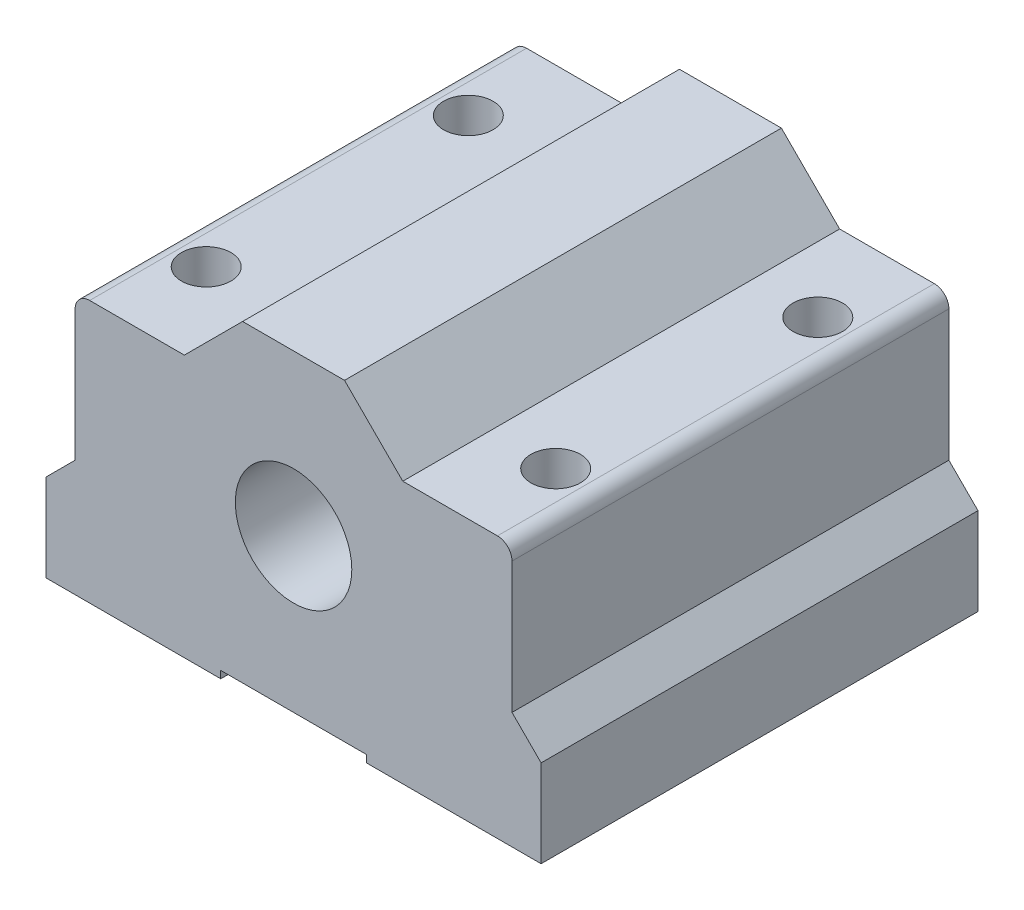
from build123d import *
from build123d.topology import SkipClean

# Parameters (mm, degrees)
SKETCH_1_W          = 34
SKETCH_1_H          = 22
EXTRUDE_1_DEPTH     = 30
SKETCH_2_R          = 4
CUT_EXTRUDE_1_DEPTH = 51.398412673
SKETCH_3_W          = 10
SKETCH_3_H          = 0.5
CUT_EXTRUDE_2_DEPTH = 51.398412673
FILLET_1_R          = 1
SKETCH_4_R          = 1.7
CUT_EXTRUDE_3_DEPTH = 51.398412673
THREAD_1_PITCH      = 0.7
THREAD_2_PITCH      = 0.7
THREAD_3_PITCH      = 0.7
THREAD_4_PITCH      = 0.7


with BuildPart() as part:
    # Sketch 1 → 凸台-拉伸1 (new body)
    with BuildSketch(Plane.XY):
        with Locations((17, 11)):
            Rectangle(SKETCH_1_W, SKETCH_1_H)
    extrude(amount=EXTRUDE_1_DEPTH)

    # Sketch 2 → 切除-拉伸1 (cut, through all)
    with BuildSketch(Plane.XY.offset(30)):
        Polygon((0, 22), (0, 18), (9.5, 18), (13.5, 22), align=None)
        Polygon((34, 22), (20.5, 22), (24.5, 18), (34, 18), align=None)
        with Locations((17, 11)):
            Circle(SKETCH_2_R)
    extrude(amount=-CUT_EXTRUDE_1_DEPTH, mode=Mode.SUBTRACT)

    # Sketch 3 → 切除-拉伸2 (cut, through all)
    with BuildSketch(Plane.XY.offset(30)):
        Polygon((0, 6), (2, 8), (2, 18), (0, 18), align=None)
        with Locations((17, 0.25)):
            Rectangle(SKETCH_3_W, SKETCH_3_H)
        Polygon((34, 6), (32, 8), (32, 18), (34, 18), align=None)
    extrude(amount=-CUT_EXTRUDE_2_DEPTH, mode=Mode.SUBTRACT)

    # 圆角1
    fillet_1_edges = [part.edges().sort_by_distance(p)[0] for p in [
        (2, 18, 15),
        (32, 18, 15),
    ]]
    fillet(fillet_1_edges, radius=FILLET_1_R)

    # Sketch 4 → 切除-拉伸3 (cut, through all)
    with BuildSketch(Plane.XZ):
        with Locations(Location((5, 24, 0), (0, 0, 270))):
            Circle(SKETCH_4_R)
        with Locations(Location((29, 24, 0), (0, 0, 90))):
            Circle(SKETCH_4_R)
        with Locations(Location((5, 6, 0), (0, 0, 270))):
            Circle(SKETCH_4_R)
        with Locations(Location((29, 6, 0), (0, 0, 270))):
            Circle(SKETCH_4_R)
    extrude(amount=-CUT_EXTRUDE_3_DEPTH, mode=Mode.SUBTRACT)

    # 螺纹线1: the profile of Sketch 1 2 profile screwed along a right-hand helix of 11.428571 turns, 6 arcs to a turn; built about Z, then put on its axis
    thread_1_z = Axis((0, 0, 0), (0, 0, 1))
    thread_1_corners = [(1.7003, 0, -0.000173205), (1.7003, 0, 0.612673203), (1.321113887, 0, 0.393749999), (1.321113887, 0, 0.218749999)]
    with BuildLine(mode=Mode.PRIVATE) as thread_1_profile:
        Line(thread_1_corners[0], thread_1_corners[1])
        Line(thread_1_corners[1], thread_1_corners[2])
        Line(thread_1_corners[2], thread_1_corners[3])
        Line(thread_1_corners[3], thread_1_corners[0])
    thread_1_cap = Face(thread_1_profile.wire())
    thread_1_turn_angles = [0, 30, 60, 90, 120, 150, 180, 210, 240, 270, 300, 330, 360]
    thread_1_turn_weights = [1, 0.8660254037844387, 1, 0.8660254037844387, 1, 0.8660254037844387, 1, 0.8660254037844387, 1, 0.8660254037844387, 1, 0.8660254037844387, 1]
    thread_1_turn_rails = [Edge.make_bspline([Vector(p[0], p[1], 0).rotate(thread_1_z, thread_1_turn_angles[k]) / thread_1_turn_weights[k] + Vector(0, 0, p[2] + THREAD_1_PITCH * thread_1_turn_angles[k] / 360) for k in range(13)], [0, 0, 0, 1, 1, 2, 2, 3, 3, 4, 4, 5, 5, 6, 6, 6], 2, thread_1_turn_weights) for p in thread_1_corners]
    thread_1_turn_sides = [Face.make_surface_from_curves(thread_1_turn_rails[p[0]], thread_1_turn_rails[p[1]]) for p in [(0, 1), (1, 2), (2, 3), (3, 0)]]
    thread_1_last_angles = [3960, 3990, 4020, 4050, 4080, 4097.142857143, 4114.285714286]
    thread_1_last_weights = [1, 0.8660254037844387, 1, 0.8660254037844387, 1, 0.9555728057861397, 1]
    thread_1_last_rails = [Edge.make_bspline([Vector(p[0], p[1], 0).rotate(thread_1_z, thread_1_last_angles[k]) / thread_1_last_weights[k] + Vector(0, 0, p[2] + THREAD_1_PITCH * thread_1_last_angles[k] / 360) for k in range(7)], [0, 0, 0, 1, 1, 2, 2, 3, 3, 3], 2, thread_1_last_weights) for p in thread_1_corners]
    thread_1_last_sides = [Face.make_surface_from_curves(thread_1_last_rails[p[0]], thread_1_last_rails[p[1]]) for p in [(0, 1), (1, 2), (2, 3), (3, 0)]]
    thread_1 = Plane(origin=(5, 0, 24), x_dir=(1, 0, 0), z_dir=(0, 1, 0)) * Solid(Shell([*[p.moved(Location((0, 0, THREAD_1_PITCH * i))) for i in range(11) for p in thread_1_turn_sides], *thread_1_last_sides, thread_1_cap, thread_1_cap.rotate(thread_1_z, 4114.285714286).moved(Location((0, 0, THREAD_1_PITCH * 4114.285714286 / 360)))]))
    add(thread_1)

    # 螺纹线2: the profile of Sketch 2 2 profile screwed along a right-hand helix of 11.428571 turns, 6 arcs to a turn; built about Z, then put on its axis
    with SkipClean():  # the faces are left unmerged after this step: merging them gives an invalid solid
        thread_2_z = Axis((0, 0, 0), (0, 0, 1))
        thread_2_corners = [(1.7003, 0, -0.000173205), (1.7003, 0, 0.612673203), (1.321113887, 0, 0.393749999), (1.321113887, 0, 0.218749999)]
        with BuildLine(mode=Mode.PRIVATE) as thread_2_profile:
            Line(thread_2_corners[0], thread_2_corners[1])
            Line(thread_2_corners[1], thread_2_corners[2])
            Line(thread_2_corners[2], thread_2_corners[3])
            Line(thread_2_corners[3], thread_2_corners[0])
        thread_2_cap = Face(thread_2_profile.wire())
        thread_2_turn_angles = [0, 30, 60, 90, 120, 150, 180, 210, 240, 270, 300, 330, 360]
        thread_2_turn_weights = [1, 0.8660254037844387, 1, 0.8660254037844387, 1, 0.8660254037844387, 1, 0.8660254037844387, 1, 0.8660254037844387, 1, 0.8660254037844387, 1]
        thread_2_turn_rails = [Edge.make_bspline([Vector(p[0], p[1], 0).rotate(thread_2_z, thread_2_turn_angles[k]) / thread_2_turn_weights[k] + Vector(0, 0, p[2] + THREAD_2_PITCH * thread_2_turn_angles[k] / 360) for k in range(13)], [0, 0, 0, 1, 1, 2, 2, 3, 3, 4, 4, 5, 5, 6, 6, 6], 2, thread_2_turn_weights) for p in thread_2_corners]
        thread_2_turn_sides = [Face.make_surface_from_curves(thread_2_turn_rails[p[0]], thread_2_turn_rails[p[1]]) for p in [(0, 1), (1, 2), (2, 3), (3, 0)]]
        thread_2_last_angles = [3960, 3990, 4020, 4050, 4080, 4097.142857143, 4114.285714286]
        thread_2_last_weights = [1, 0.8660254037844387, 1, 0.8660254037844387, 1, 0.9555728057861397, 1]
        thread_2_last_rails = [Edge.make_bspline([Vector(p[0], p[1], 0).rotate(thread_2_z, thread_2_last_angles[k]) / thread_2_last_weights[k] + Vector(0, 0, p[2] + THREAD_2_PITCH * thread_2_last_angles[k] / 360) for k in range(7)], [0, 0, 0, 1, 1, 2, 2, 3, 3, 3], 2, thread_2_last_weights) for p in thread_2_corners]
        thread_2_last_sides = [Face.make_surface_from_curves(thread_2_last_rails[p[0]], thread_2_last_rails[p[1]]) for p in [(0, 1), (1, 2), (2, 3), (3, 0)]]
        thread_2 = Plane(origin=(5, 0, 6), x_dir=(1, 0, 0), z_dir=(0, 1, 0)) * Solid(Shell([*[p.moved(Location((0, 0, THREAD_2_PITCH * i))) for i in range(11) for p in thread_2_turn_sides], *thread_2_last_sides, thread_2_cap, thread_2_cap.rotate(thread_2_z, 4114.285714286).moved(Location((0, 0, THREAD_2_PITCH * 4114.285714286 / 360)))]))
        add(thread_2)

    # 螺纹线3: the profile of Sketch 3 2 profile screwed along a right-hand helix of 11.428571 turns, 6 arcs to a turn; built about Z, then put on its axis
    thread_3_z = Axis((0, 0, 0), (0, 0, 1))
    thread_3_corners = [(1.7003, 0, -0.000173205), (1.7003, 0, 0.612673203), (1.321113888, 0, 0.393749999), (1.321113888, 0, 0.218749999)]
    with BuildLine(mode=Mode.PRIVATE) as thread_3_profile:
        Line(thread_3_corners[0], thread_3_corners[1])
        Line(thread_3_corners[1], thread_3_corners[2])
        Line(thread_3_corners[2], thread_3_corners[3])
        Line(thread_3_corners[3], thread_3_corners[0])
    thread_3_cap = Face(thread_3_profile.wire())
    thread_3_turn_angles = [0, 30, 60, 90, 120, 150, 180, 210, 240, 270, 300, 330, 360]
    thread_3_turn_weights = [1, 0.8660254037844387, 1, 0.8660254037844387, 1, 0.8660254037844387, 1, 0.8660254037844387, 1, 0.8660254037844387, 1, 0.8660254037844387, 1]
    thread_3_turn_rails = [Edge.make_bspline([Vector(p[0], p[1], 0).rotate(thread_3_z, thread_3_turn_angles[k]) / thread_3_turn_weights[k] + Vector(0, 0, p[2] + THREAD_3_PITCH * thread_3_turn_angles[k] / 360) for k in range(13)], [0, 0, 0, 1, 1, 2, 2, 3, 3, 4, 4, 5, 5, 6, 6, 6], 2, thread_3_turn_weights) for p in thread_3_corners]
    thread_3_turn_sides = [Face.make_surface_from_curves(thread_3_turn_rails[p[0]], thread_3_turn_rails[p[1]]) for p in [(0, 1), (1, 2), (2, 3), (3, 0)]]
    thread_3_last_angles = [3960, 3990, 4020, 4050, 4080, 4097.142857143, 4114.285714286]
    thread_3_last_weights = [1, 0.8660254037844387, 1, 0.8660254037844387, 1, 0.9555728057861397, 1]
    thread_3_last_rails = [Edge.make_bspline([Vector(p[0], p[1], 0).rotate(thread_3_z, thread_3_last_angles[k]) / thread_3_last_weights[k] + Vector(0, 0, p[2] + THREAD_3_PITCH * thread_3_last_angles[k] / 360) for k in range(7)], [0, 0, 0, 1, 1, 2, 2, 3, 3, 3], 2, thread_3_last_weights) for p in thread_3_corners]
    thread_3_last_sides = [Face.make_surface_from_curves(thread_3_last_rails[p[0]], thread_3_last_rails[p[1]]) for p in [(0, 1), (1, 2), (2, 3), (3, 0)]]
    thread_3 = Plane(origin=(29, 0, 24), x_dir=(1, 0, 0), z_dir=(0, 1, 0)) * Solid(Shell([*[p.moved(Location((0, 0, THREAD_3_PITCH * i))) for i in range(11) for p in thread_3_turn_sides], *thread_3_last_sides, thread_3_cap, thread_3_cap.rotate(thread_3_z, 4114.285714286).moved(Location((0, 0, THREAD_3_PITCH * 4114.285714286 / 360)))]))
    add(thread_3)

    # 螺纹线4: the profile of Sketch 4 2 profile screwed along a right-hand helix of 11.428571 turns, 6 arcs to a turn; built about Z, then put on its axis
    with SkipClean():  # the faces are left unmerged after this step: merging them gives an invalid solid
        thread_4_z = Axis((0, 0, 0), (0, 0, 1))
        thread_4_corners = [(1.7003, 0, -0.000173205), (1.7003, 0, 0.612673203), (1.321113888, 0, 0.393749999), (1.321113888, 0, 0.218749999)]
        with BuildLine(mode=Mode.PRIVATE) as thread_4_profile:
            Line(thread_4_corners[0], thread_4_corners[1])
            Line(thread_4_corners[1], thread_4_corners[2])
            Line(thread_4_corners[2], thread_4_corners[3])
            Line(thread_4_corners[3], thread_4_corners[0])
        thread_4_cap = Face(thread_4_profile.wire())
        thread_4_turn_angles = [0, 30, 60, 90, 120, 150, 180, 210, 240, 270, 300, 330, 360]
        thread_4_turn_weights = [1, 0.8660254037844387, 1, 0.8660254037844387, 1, 0.8660254037844387, 1, 0.8660254037844387, 1, 0.8660254037844387, 1, 0.8660254037844387, 1]
        thread_4_turn_rails = [Edge.make_bspline([Vector(p[0], p[1], 0).rotate(thread_4_z, thread_4_turn_angles[k]) / thread_4_turn_weights[k] + Vector(0, 0, p[2] + THREAD_4_PITCH * thread_4_turn_angles[k] / 360) for k in range(13)], [0, 0, 0, 1, 1, 2, 2, 3, 3, 4, 4, 5, 5, 6, 6, 6], 2, thread_4_turn_weights) for p in thread_4_corners]
        thread_4_turn_sides = [Face.make_surface_from_curves(thread_4_turn_rails[p[0]], thread_4_turn_rails[p[1]]) for p in [(0, 1), (1, 2), (2, 3), (3, 0)]]
        thread_4_last_angles = [3960, 3990, 4020, 4050, 4080, 4097.142857143, 4114.285714286]
        thread_4_last_weights = [1, 0.8660254037844387, 1, 0.8660254037844387, 1, 0.9555728057861397, 1]
        thread_4_last_rails = [Edge.make_bspline([Vector(p[0], p[1], 0).rotate(thread_4_z, thread_4_last_angles[k]) / thread_4_last_weights[k] + Vector(0, 0, p[2] + THREAD_4_PITCH * thread_4_last_angles[k] / 360) for k in range(7)], [0, 0, 0, 1, 1, 2, 2, 3, 3, 3], 2, thread_4_last_weights) for p in thread_4_corners]
        thread_4_last_sides = [Face.make_surface_from_curves(thread_4_last_rails[p[0]], thread_4_last_rails[p[1]]) for p in [(0, 1), (1, 2), (2, 3), (3, 0)]]
        thread_4 = Plane(origin=(29, 0, 6), x_dir=(1, 0, 0), z_dir=(0, 1, 0)) * Solid(Shell([*[p.moved(Location((0, 0, THREAD_4_PITCH * i))) for i in range(11) for p in thread_4_turn_sides], *thread_4_last_sides, thread_4_cap, thread_4_cap.rotate(thread_4_z, 4114.285714286).moved(Location((0, 0, THREAD_4_PITCH * 4114.285714286 / 360)))]))
        add(thread_4)


solid = part.part
